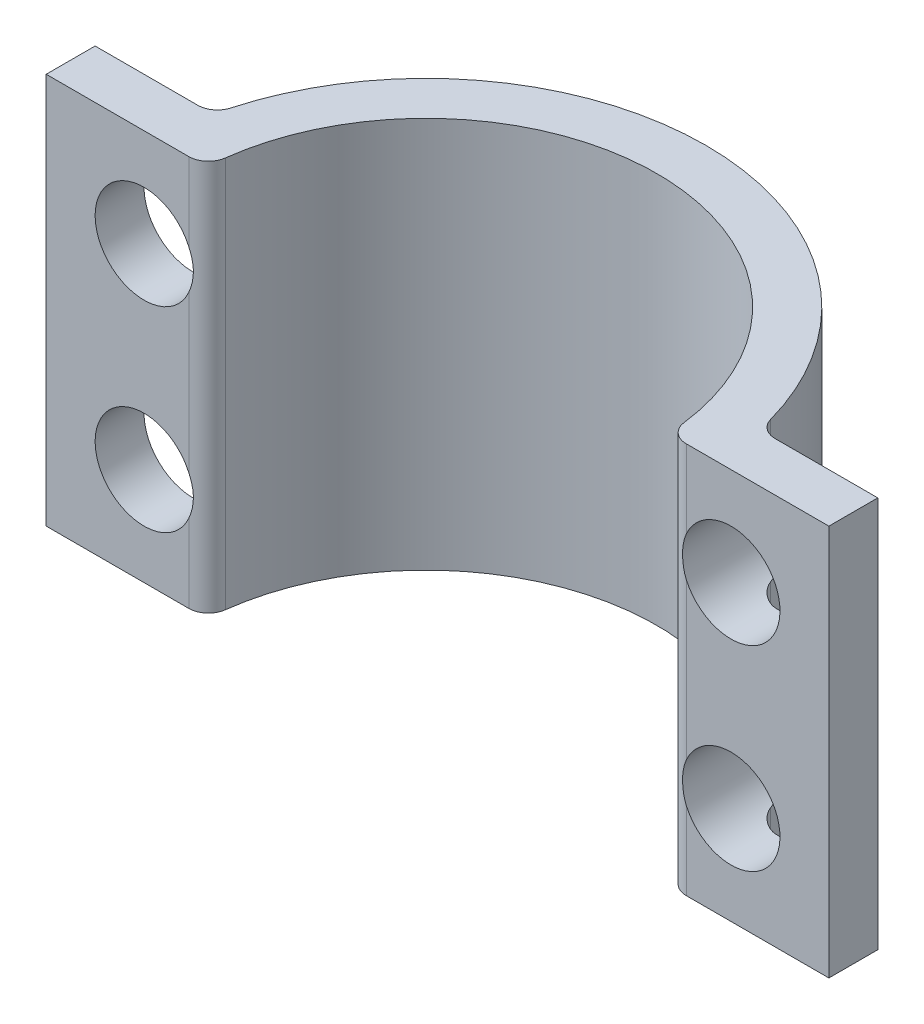
from build123d import *

# Parameters (mm, degrees)
BOSS_EXTRUDE1_DEPTH = 25.4
SKETCH3_R           = 3.175
CUT_EXTRUDE1_DEPTH  = 51.78354129
FILLET1_R           = 1.27


with BuildPart() as part:
    # Sketch2 → Boss-Extrude1 (new body)
    with BuildSketch(Plane(origin=(0, 0, 0), x_dir=(1, 0, 0), z_dir=(0, 1, 0))):
        with BuildLine():
            Line((0, 0), (-10.419367303, 0))
            Line((-10.419367303, 0), (-10.419367303, 3.175))
            Line((-10.419367303, 3.175), (-2.762835284, 3.175))
            ThreePointArc((-2.762835284, 3.175), (14.980632697, 17.413), (32.724100678, 3.175))
            Line((32.724100678, 3.175), (40.380632697, 3.175))
            Line((40.380632697, 3.175), (40.380632697, 0))
            Line((40.380632697, 0), (29.961265394, 0))
            ThreePointArc((29.961265394, 0), (14.980632697, 14.238), (0, 0))
        make_face()
    extrude(amount=-BOSS_EXTRUDE1_DEPTH)

    # Sketch3 → Cut-Extrude1 (cut, through all)
    with BuildSketch(Plane.XY):
        with Locations((-4.069367303, -6.35)):
            Circle(SKETCH3_R)
        with Locations((34.030632697, -6.35)):
            Circle(SKETCH3_R)
        with Locations((-4.069367303, -19.05)):
            Circle(SKETCH3_R)
        with Locations((34.030632697, -19.05)):
            Circle(SKETCH3_R)
    extrude(amount=-CUT_EXTRUDE1_DEPTH, mode=Mode.SUBTRACT)

    # Fillet1
    # the kernel refuses this fillet: 1.27 mm, written as the material it adds along each edge
    with BuildSketch(Plane(origin=(32.724100678, 0, -3.175), x_dir=(1, 0, 0), z_dir=(0, -1, 0))) as fillet1_piece_1_section:
        with BuildLine():
            CenterArc((0.991397271, -1.27), FILLET1_R, 90, 74.467738735)
            ThreePointArc((-0.232222111, -0.929918231), (-0.109979978, -0.466490187), (0, 0))
            Line((0, 0), (0.991397271, 0))
        make_face()
    fillet1_piece_1 = extrude(amount=5.934776002, mode=Mode.PRIVATE)
    fillet1_piece_1 = fillet1_piece_1 - Plane(origin=(34.030632697, -6.35, -3.384746049), x_dir=(1, 0, 0), z_dir=(0, 0, 1)) * Cylinder(3.175, 16, mode=Mode.PRIVATE)
    add(fillet1_piece_1)
    with BuildSketch(Plane(origin=(32.724100678, -19.465223998, -3.175), x_dir=(1, 0, 0), z_dir=(0, -1, 0))) as fillet1_piece_2_section:
        with BuildLine():
            CenterArc((0.991397271, -1.27), FILLET1_R, 90, 74.467738735)
            ThreePointArc((-0.232222111, -0.929918231), (-0.109979978, -0.466490187), (0, 0))
            Line((0, 0), (0.991397271, 0))
        make_face()
    fillet1_piece_2 = extrude(amount=5.934776002, mode=Mode.PRIVATE)
    fillet1_piece_2 = fillet1_piece_2 - Plane(origin=(34.030632697, -19.05, -3.384746046), x_dir=(1, 0, 0), z_dir=(0, 0, 1)) * Cylinder(3.175, 16, mode=Mode.PRIVATE)
    add(fillet1_piece_2)
    with BuildSketch(Plane(origin=(32.724100678, -6.765223998, -3.175), x_dir=(1, 0, 0), z_dir=(0, -1, 0))) as fillet1_piece_3_section:
        with BuildLine():
            CenterArc((0.991397271, -1.27), FILLET1_R, 90, 74.467738735)
            ThreePointArc((-0.232222111, -0.929918231), (-0.109979978, -0.466490187), (0, 0))
            Line((0, 0), (0.991397271, 0))
        make_face()
    fillet1_piece_3 = extrude(amount=11.869552004, mode=Mode.PRIVATE)
    fillet1_piece_3 = fillet1_piece_3 - Plane(origin=(34.030632697, -19.05, -3.384746051), x_dir=(1, 0, 0), z_dir=(0, 0, 1)) * Cylinder(3.175, 28, mode=Mode.PRIVATE)
    fillet1_piece_3 = fillet1_piece_3 - Plane(origin=(34.030632697, -6.35, -3.384746051), x_dir=(1, 0, 0), z_dir=(0, 0, 1)) * Cylinder(3.175, 28, mode=Mode.PRIVATE)
    add(fillet1_piece_3)
    with BuildSketch(Plane(origin=(-2.762835284, 0, -3.175), x_dir=(0.24228281636804117, 0, -0.9702056673163532), z_dir=(0, -1, 0))) as fillet1_piece_4_section:
        with BuildLine():
            CenterArc((0.991962675, -1.269558427), FILLET1_R, 91.510947972, 74.467738735)
            Line((-0.240198523, -0.96185925), (0, 0))
            ThreePointArc((0, 0), (0.479237682, -0.006319359), (0.958475365, 0))
        make_face()
    fillet1_piece_4 = extrude(amount=5.934776002, mode=Mode.PRIVATE)
    fillet1_piece_4 = fillet1_piece_4 - Plane(origin=(-4.069367303, -6.35, -3.384746045), x_dir=(1, 0, 0), z_dir=(0, 0, 1)) * Cylinder(3.175, 16, mode=Mode.PRIVATE)
    add(fillet1_piece_4)
    with BuildSketch(Plane(origin=(-2.762835284, -19.465223998, -3.175), x_dir=(0.24228281636804025, 0, -0.9702056673163533), z_dir=(0, -1, 0))) as fillet1_piece_5_section:
        with BuildLine():
            CenterArc((0.991962675, -1.269558427), FILLET1_R, 91.510947972, 74.467738735)
            Line((-0.240198523, -0.96185925), (0, 0))
            ThreePointArc((0, 0), (0.479237682, -0.006319359), (0.958475365, 0))
        make_face()
    fillet1_piece_5 = extrude(amount=5.934776002, mode=Mode.PRIVATE)
    fillet1_piece_5 = fillet1_piece_5 - Plane(origin=(-4.069367303, -19.05, -3.384746049), x_dir=(1, 0, 0), z_dir=(0, 0, 1)) * Cylinder(3.175, 16, mode=Mode.PRIVATE)
    add(fillet1_piece_5)
    with BuildSketch(Plane(origin=(-2.762835284, -6.765223998, -3.175), x_dir=(0.24228281636804025, 0, -0.9702056673163533), z_dir=(0, -1, 0))) as fillet1_piece_6_section:
        with BuildLine():
            CenterArc((0.991962675, -1.269558427), FILLET1_R, 91.510947972, 74.467738735)
            Line((-0.240198523, -0.96185925), (0, 0))
            ThreePointArc((0, 0), (0.479237682, -0.006319359), (0.958475365, 0))
        make_face()
    fillet1_piece_6 = extrude(amount=11.869552004, mode=Mode.PRIVATE)
    fillet1_piece_6 = fillet1_piece_6 - Plane(origin=(-4.069367303, -19.05, -3.38474605), x_dir=(1, 0, 0), z_dir=(0, 0, 1)) * Cylinder(3.175, 28, mode=Mode.PRIVATE)
    fillet1_piece_6 = fillet1_piece_6 - Plane(origin=(-4.069367303, -6.35, -3.38474605), x_dir=(1, 0, 0), z_dir=(0, 0, 1)) * Cylinder(3.175, 28, mode=Mode.PRIVATE)
    add(fillet1_piece_6)
    # the kernel refuses this fillet: 1.27 mm, written as the material it takes off along each edge
    with BuildSketch(Plane(origin=(29.961265394, 2.904944682, 0), x_dir=(1, 0, 0), z_dir=(0, -1, 0))) as fillet1_2_piece_1:
        with BuildLine():
            CenterArc((1.161977873, -1.27), FILLET1_R, 90, 82.825455624)
            ThreePointArc((-0.098078392, -1.111386601), (-0.038702449, -0.556605505), (0, 0))
            Line((0, 0), (1.161977873, 0))
        make_face()
    extrude(amount=31.209889363, mode=Mode.SUBTRACT)
    with BuildSketch(Plane(origin=(0, 2.904944682, 0), x_dir=(0.08790703364755922, 0, -0.996128683170647), z_dir=(0, -1, 0))) as fillet1_2_piece_2:
        with BuildLine():
            CenterArc((1.1629374, -1.269121421), FILLET1_R, 92.131332721, 82.825455624)
            Line((-0.102146028, -1.157479488), (0, 0))
            ThreePointArc((0, 0), (0.557852926, -0.010376919), (1.115705852, 0))
        make_face()
    extrude(amount=31.209889363, mode=Mode.SUBTRACT)


solid = part.part
